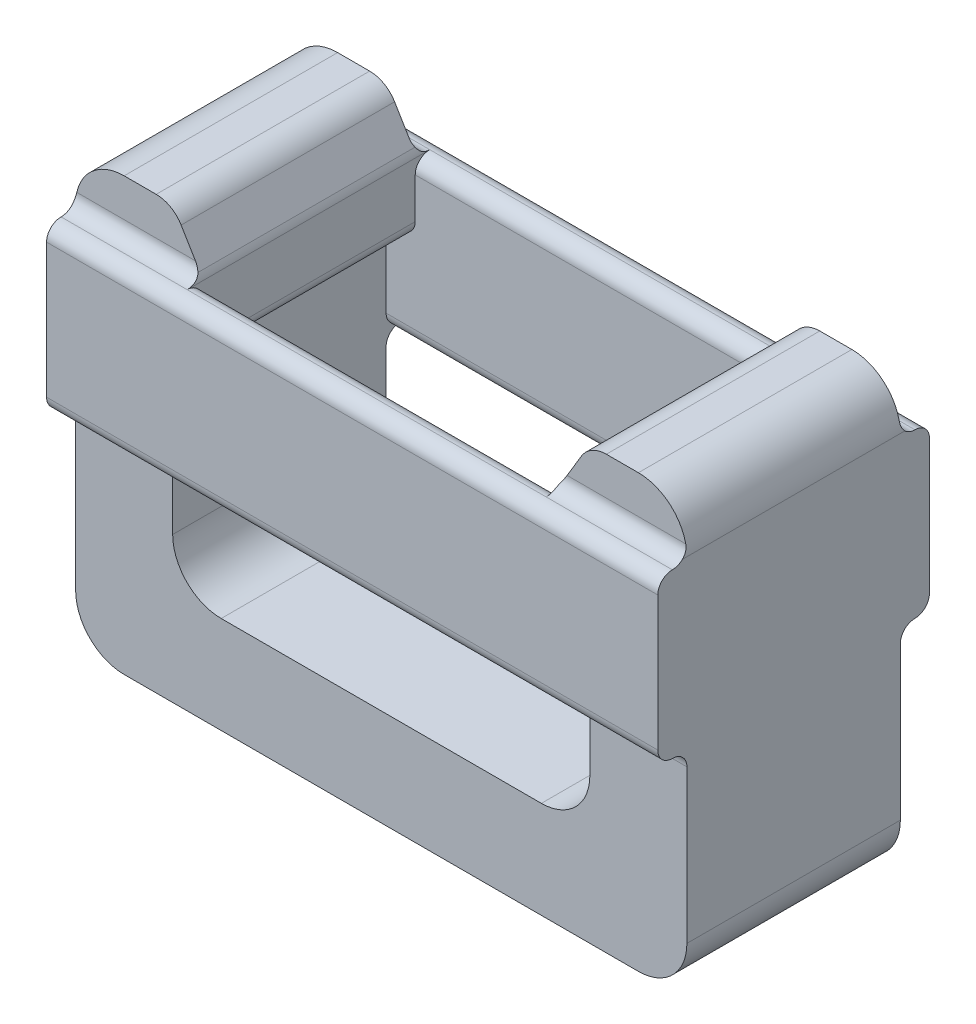
from build123d import *

# Parameters (mm, degrees)
BOSS_EXTRUDE1_DEPTH = 22
FILLET2_R           = 5
FILLET4_R           = 5
FILLET5_R           = 1.5
FILLET6_R           = 3
FILLET7_R           = 1.5
SKETCH5_W           = 63
SKETCH5_H           = 16.840827273
BOSS_EXTRUDE2_DEPTH = 3
SKETCH6_W           = 63
SKETCH6_H           = 16.840827273
BOSS_EXTRUDE3_DEPTH = 3
FILLET8_R           = 1.5
FILLET9_R           = 1.5


with BuildPart() as part:
    # Sketch1 → Boss-Extrude1 (new body)
    with BuildSketch(Plane(origin=(0, 0, 0), x_dir=(0, 1, 0), z_dir=(0, 0, 1))):
        Polygon((0, 0), (44.512606441, 0), (44.512606441, 10), (39.512606441, 13), (31.925649919, 13), (31.925649919, 10), (10, 10), (10, 53), (31.925649919, 53), (31.925649919, 50), (39.512606441, 50), (44.512606441, 53), (44.512606441, 63), (0, 63), align=None)
    extrude(amount=BOSS_EXTRUDE1_DEPTH)

    # Fillet2
    fillet2_edges = [part.edges().sort_by_distance(p)[0] for p in [
        (-63, 0, 11),
        (-63, 44.512606441, 11),
        (0, 44.512606441, 11),
        (0, 0, 11),
    ]]
    fillet(fillet2_edges, radius=FILLET2_R)

    # Fillet4
    fillet4_edges = [part.edges().sort_by_distance(p)[0] for p in [
        (-53, 10, 11),
        (-10, 10, 11),
    ]]
    fillet(fillet4_edges, radius=FILLET4_R)

    # Fillet5
    fillet5_edges = [part.edges().sort_by_distance(p)[0] for p in [
        (-53, 31.925649919, 11),
        (-10, 31.925649919, 11),
    ]]
    fillet(fillet5_edges, radius=FILLET5_R)

    # Fillet6
    fillet6_edges = [part.edges().sort_by_distance(p)[0] for p in [
        (-53, 44.512606441, 11),
        (-10, 44.512606441, 11),
    ]]
    fillet(fillet6_edges, radius=FILLET6_R)

    # Fillet7
    fillet7_edges = [part.edges().sort_by_distance(p)[0] for p in [
        (-13, 39.512606441, 11),
        (-50, 39.512606441, 11),
        (-50, 31.925649919, 11),
        (-13, 31.925649919, 11),
    ]]
    fillet(fillet7_edges, radius=FILLET7_R - 0.0001)  # a hair under: the kernel refuses the full size

    # Sketch5 → Boss-Extrude2 (add)
    with BuildSketch(Plane.XY.offset(22)):
        with Locations((-31.5, 30.676716857)):
            Rectangle(SKETCH5_W, SKETCH5_H)
    extrude(amount=BOSS_EXTRUDE2_DEPTH)

    # Sketch6 → Boss-Extrude3 (add)
    with BuildSketch(Plane(origin=(0, 0, 0), x_dir=(1, 0, 0), z_dir=(0, 0, -1))):
        with Locations((-31.5, -30.676716857)):
            Rectangle(SKETCH6_W, SKETCH6_H)
    extrude(amount=BOSS_EXTRUDE3_DEPTH)

    # Fillet8
    fillet8_edges = [part.edges().sort_by_distance(p)[0] for p in [
        (-31.5, 22.25630322, 22),
        (-31.5, 39.097130493, 25),
        (-31.5, 22.25630322, 25),
        (-31.5, 39.097130493, 22),
        (-31.5, 39.097130493, 0),
        (-31.5, 22.25630322, 0),
        (-31.5, 39.097130493, -3),
        (-31.5, 22.25630322, -3),
    ]]
    fillet(fillet8_edges, radius=FILLET8_R - 0.0001)  # a hair under: the kernel refuses the full size

    # Fillet9
    fillet9_edges = [part.edges().sort_by_distance(p)[0] for p in [
        (-5, 22.25630322, 22),
    ]]
    fillet(fillet9_edges, radius=FILLET9_R - 0.0001)  # a hair under: the kernel refuses the full size
    fillet9_2_edges = [part.edges().sort_by_distance(p)[0] for p in [
        (-58, 22.25630322, 22),
    ]]
    fillet(fillet9_2_edges, radius=FILLET9_R - 0.0001)  # a hair under: the kernel refuses the full size
    fillet9_3_edges = [part.edges().sort_by_distance(p)[0] for p in [
        (-58, 22.25630322, 0),
    ]]
    fillet(fillet9_3_edges, radius=FILLET9_R - 0.0001)  # a hair under: the kernel refuses the full size
    fillet9_4_edges = [part.edges().sort_by_distance(p)[0] for p in [
        (-5, 22.25630322, 0),
    ]]
    fillet(fillet9_4_edges, radius=FILLET9_R - 0.0001)  # a hair under: the kernel refuses the full size
    fillet9_5_edges = [part.edges().sort_by_distance(p)[0] for p in [
        (-56.5, 39.097130493, 22),
    ]]
    fillet(fillet9_5_edges, radius=FILLET9_R - 0.0001)  # a hair under: the kernel refuses the full size
    fillet9_6_edges = [part.edges().sort_by_distance(p)[0] for p in [
        (-6.5, 39.097130493, 22),
    ]]
    fillet(fillet9_6_edges, radius=FILLET9_R - 0.0001)  # a hair under: the kernel refuses the full size
    fillet9_7_edges = [part.edges().sort_by_distance(p)[0] for p in [
        (-6.5, 39.097130493, 0),
    ]]
    fillet(fillet9_7_edges, radius=FILLET9_R - 0.0001)  # a hair under: the kernel refuses the full size
    fillet9_8_edges = [part.edges().sort_by_distance(p)[0] for p in [
        (-56.5, 39.097130493, 0),
    ]]
    fillet(fillet9_8_edges, radius=FILLET9_R - 0.0001)  # a hair under: the kernel refuses the full size


solid = part.part
